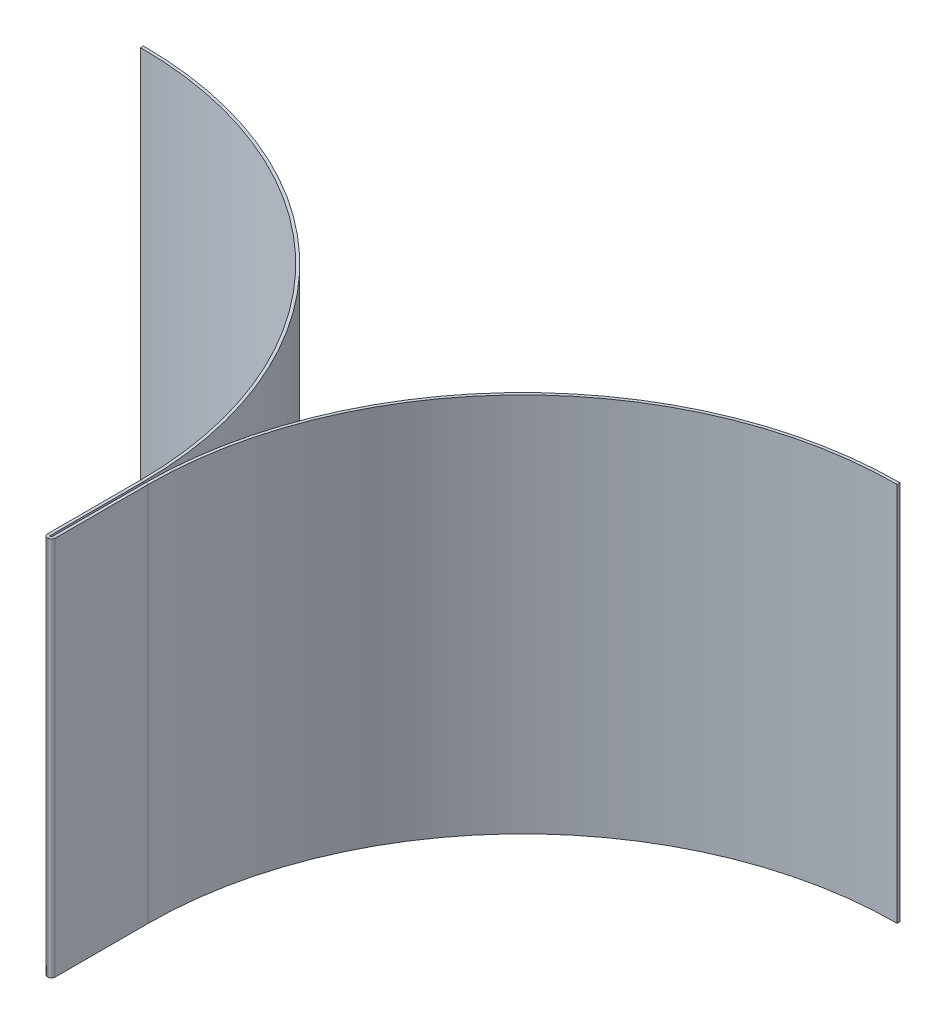
from build123d import *

# Parameters (mm, degrees)
BASE_FLANGE5_DEPTH = 200


# Sheet-metal steps are written as plain solids
with BuildPart() as part:
    # Sketch1 → Base-Flange5 (new body)
    with BuildSketch(Plane(origin=(0, 0, 0), x_dir=(1, 0, 0), z_dir=(0, 1, 0))):
        with BuildLine():
            ThreePointArc((398, 197), (258.699964106, 139.300035894), (201, 0))
            Line((201, 0), (201, -49))
            ThreePointArc((201, -49), (200.443502884, -50.343502884), (199.1, -50.9))
            Line((199.1, -50.9), (198.9, -50.9))
            ThreePointArc((198.9, -50.9), (197.556497116, -50.343502884), (197, -49))
            Line((197, -49), (197, 0))
            ThreePointArc((197, 0), (139.300035894, 139.300035894), (0, 197))
            Line((0, 197), (0, 198.5))
            ThreePointArc((0, 198.5), (140.360696066, 140.360696066), (198.5, 0))
            Line((198.5, 0), (198.5, -49))
            ThreePointArc((198.5, -49), (198.617157288, -49.282842712), (198.9, -49.4))
            Line((198.9, -49.4), (199.1, -49.4))
            ThreePointArc((199.1, -49.4), (199.382842712, -49.282842712), (199.5, -49))
            Line((199.5, -49), (199.5, 0))
            ThreePointArc((199.5, 0), (257.639303934, 140.360696066), (398, 198.5))
            Line((398, 198.5), (398, 197))
        make_face()
    extrude(amount=BASE_FLANGE5_DEPTH)


solid = part.part
